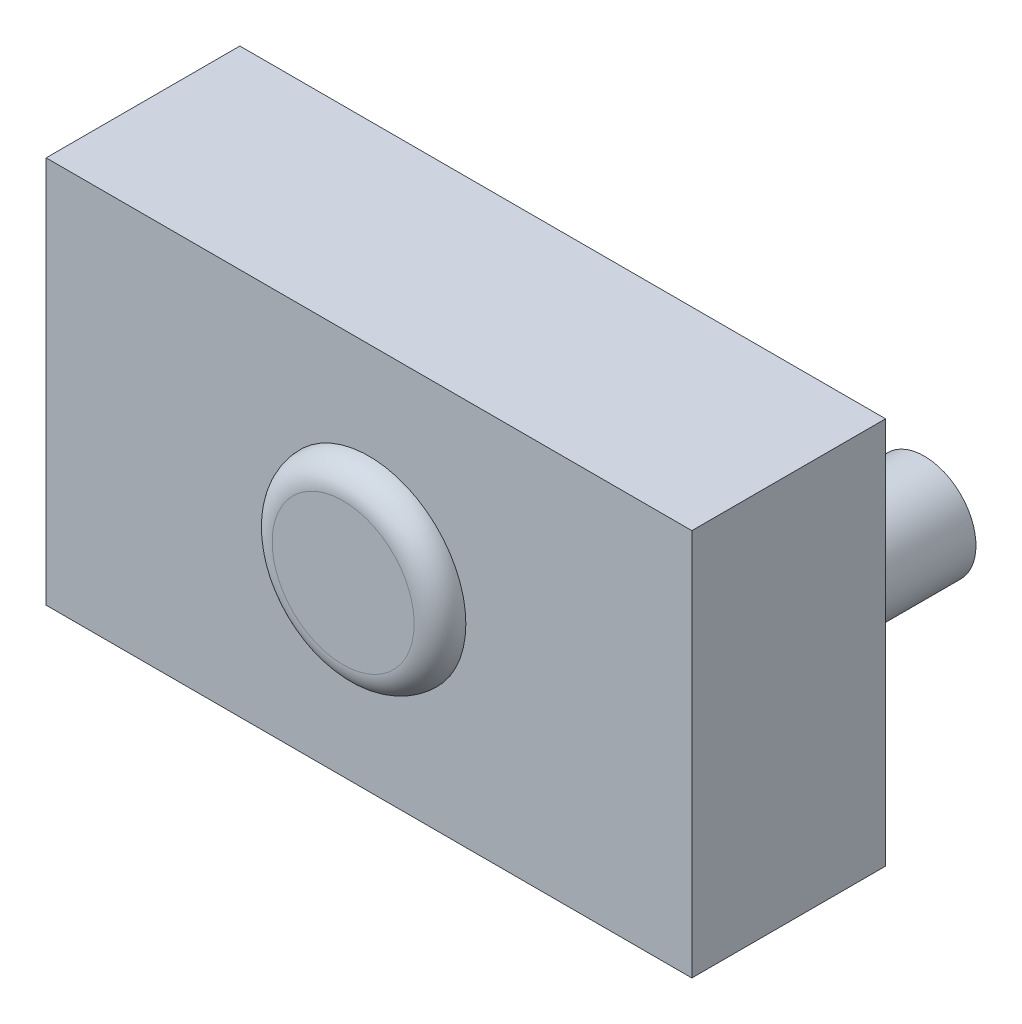
from build123d import *

# Parameters (mm, degrees)
SKETCH1_W           = 50
SKETCH1_H           = 30
BOSS_EXTRUDE1_DEPTH = 15
SKETCH2_R           = 4
BOSS_EXTRUDE2_DEPTH = 10
SKETCH3_R           = 7.5
BOSS_EXTRUDE3_DEPTH = 2
FILLET1_R           = 2


with BuildPart() as part:
    # Sketch1 → Boss-Extrude1 (new body)
    with BuildSketch(Plane.XY):
        Rectangle(SKETCH1_W, SKETCH1_H)
    extrude(amount=BOSS_EXTRUDE1_DEPTH)

    # Sketch2 → Boss-Extrude2 (add)
    with BuildSketch(Plane(origin=(0, 0, 0), x_dir=(-1, 0, 0), z_dir=(0, 0, -1))):
        with Locations((-18, 0)):
            Circle(SKETCH2_R)
        with Locations((18, 0)):
            Circle(SKETCH2_R)
    extrude(amount=BOSS_EXTRUDE2_DEPTH)

    # Sketch3 → Boss-Extrude3 (add)
    with BuildSketch(Plane.XY.offset(15)):
        Circle(SKETCH3_R)
    extrude(amount=BOSS_EXTRUDE3_DEPTH)

    # Fillet1
    fillet1_edges = [part.edges().sort_by_distance(p)[0] for p in [
        (-7.5, 0, 17),
    ]]
    fillet(fillet1_edges, radius=FILLET1_R - 0.0001)  # a hair under: the kernel refuses the full size


solid = part.part
